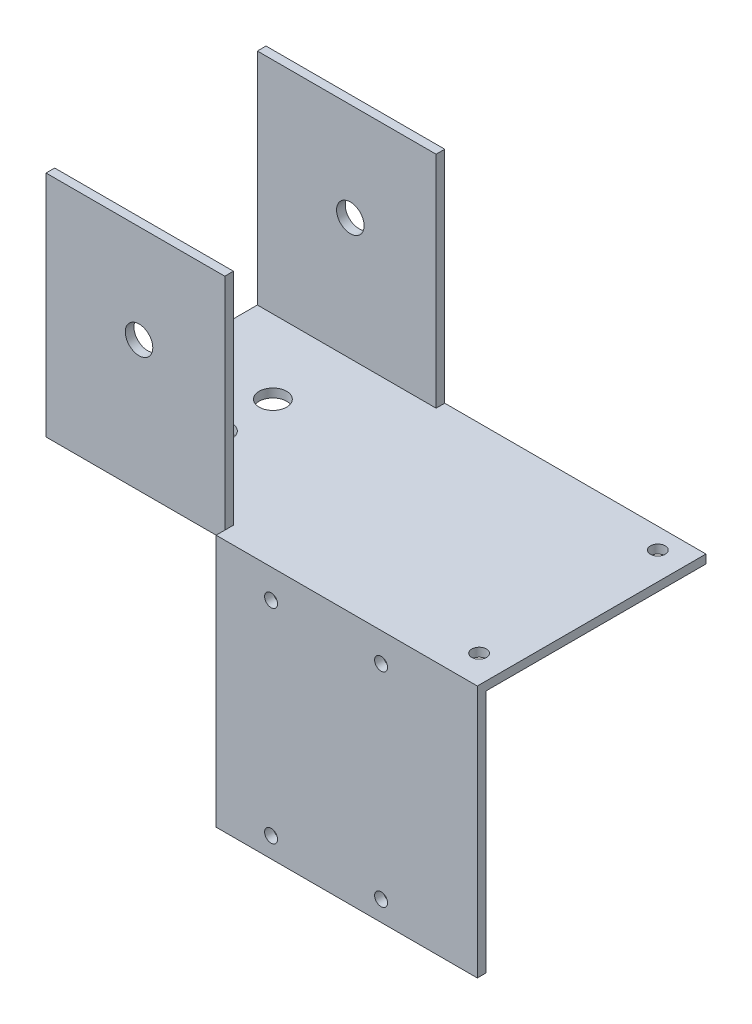
from build123d import *

# Parameters (mm, degrees)
SKETCH1_W           = 60.325
SKETCH1_H           = 58.4
SKETCH1_R           = 1.5
BOSS_EXTRUDE1_DEPTH = 2
BOSS_EXTRUDE2_DEPTH = 50.8
SKETCH3_R           = 1.7
SKETCH3_R_2         = 3.175
CUT_EXTRUDE1_DEPTH  = 100.184200481
SKETCH4_W           = 41.275
SKETCH4_H           = 2
BOSS_EXTRUDE3_DEPTH = 50.8
SKETCH5_R           = 3.175
CUT_EXTRUDE2_DEPTH  = 135.701097341


with BuildPart() as part:
    # Sketch1 → Boss-Extrude1 (new body)
    with BuildSketch(Plane.XY):
        with Locations((30.1625, 29.2)):
            Rectangle(SKETCH1_W, SKETCH1_H)
        with Locations((12.7, 51.75)):
            Circle(SKETCH1_R, mode=Mode.SUBTRACT)
        with Locations((38.1, 51.75)):
            Circle(SKETCH1_R, mode=Mode.SUBTRACT)
        with Locations((12.7, 4.65)):
            Circle(SKETCH1_R, mode=Mode.SUBTRACT)
        with Locations((38.1, 4.65)):
            Circle(SKETCH1_R, mode=Mode.SUBTRACT)
    extrude(amount=-BOSS_EXTRUDE1_DEPTH)

    # Sketch2 → Boss-Extrude2 (add)
    with BuildSketch(Plane(origin=(0, 0, -2), x_dir=(-1, 0, 0), z_dir=(0, 0, -1))):
        Polygon((0, 56.4), (41.275, 56.4), (41.275, 58.4), (0, 58.4), (-60.325, 58.4), (-60.325, 56.4), align=None)
    extrude(amount=BOSS_EXTRUDE2_DEPTH)

    # Sketch3 → Cut-Extrude1 (cut, through all)
    with BuildSketch(Plane(origin=(0, 58.4, 0), x_dir=(1, 0, 0), z_dir=(0, 1, 0))):
        with Locations((53.975, 48.0375)):
            Circle(SKETCH3_R)
        with Locations((53.975, 6.7625)):
            Circle(SKETCH3_R)
        with Locations((-20.6375, 33.75)):
            Circle(SKETCH3_R_2)
        with Locations((-20.6375, 21.05)):
            Circle(SKETCH3_R_2)
    extrude(amount=-CUT_EXTRUDE1_DEPTH, mode=Mode.SUBTRACT)

    # Sketch4 → Boss-Extrude3 (add)
    with BuildSketch(Plane(origin=(0, 58.4, 0), x_dir=(1, 0, 0), z_dir=(0, 1, 0))):
        with Locations((-20.6375, 3)):
            Rectangle(SKETCH4_W, SKETCH4_H)
        with Locations((-20.6375, 51.8)):
            Rectangle(SKETCH4_W, SKETCH4_H)
    extrude(amount=BOSS_EXTRUDE3_DEPTH)

    # Sketch5 → Cut-Extrude2 (cut, through all)
    with BuildSketch(Plane.XY.offset(-2)):
        with Locations((-19.8, 86.567958179)):
            Circle(SKETCH5_R)
    extrude(amount=-CUT_EXTRUDE2_DEPTH, mode=Mode.SUBTRACT)


solid = part.part
